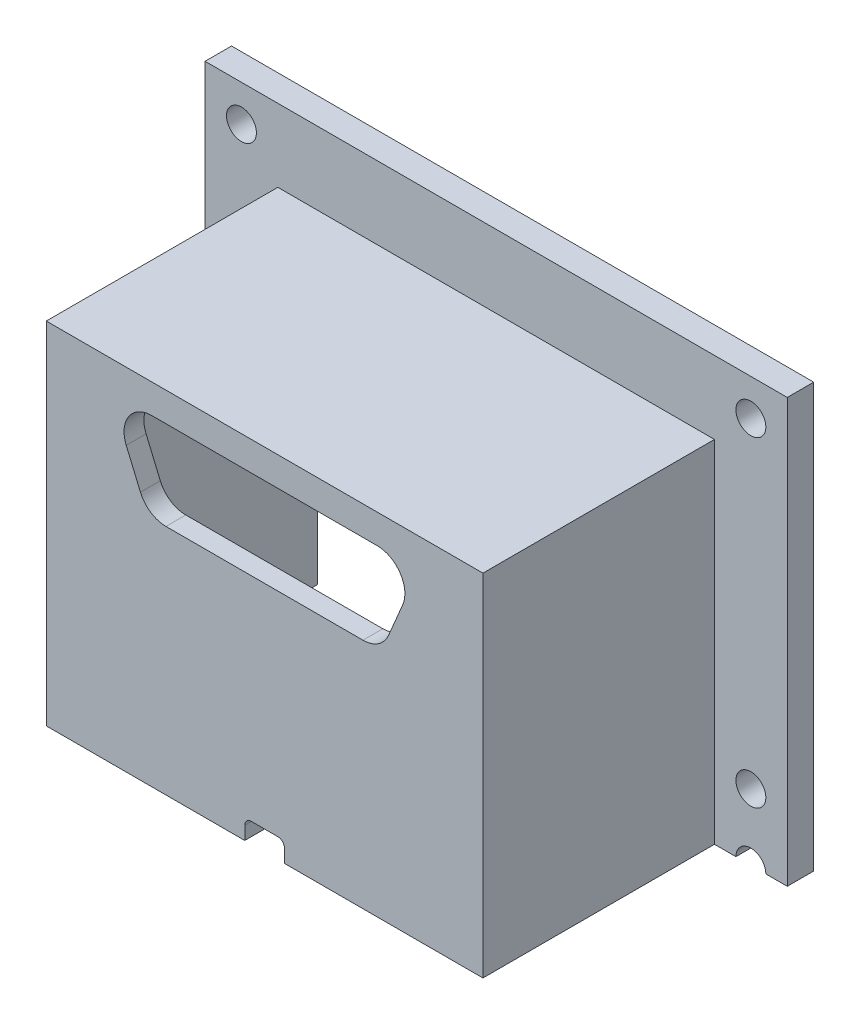
from build123d import *

# Parameters (mm, degrees)
SKETCH1_W                   = 33
SKETCH1_H                   = 53
SKETCH1_W_2                 = 31
SKETCH1_H_2                 = 51
WALL_HEIGHT_DEPTH           = 18
ROOF_START                  = 18
SKETCH1_3_W                 = 33
SKETCH1_3_H                 = 53
SKETCH1_3_W_2               = 3
SKETCH1_3_H_2               = 3
ROOF_DEPTH                  = 1.5
SKETCH1_5_W                 = 44
SKETCH1_5_H                 = 64
SKETCH1_5_R                 = 1.1303
SKETCH1_5_W_2               = 33
SKETCH1_5_H_2               = 53
SCREW_LIP_DEPTH             = 2
MICRO_D_START               = 18
MICRO_D_FEMALE_CUTOUT_DEPTH = 1.5
FILLET1_R                   = 0.5
SKETCH4_W                   = 44
SKETCH4_H                   = 32
CUT_EXTRUDE3_DEPTH          = 19.5


# Read off the part's stored shape, not the designer's step: Micro-D Female Cutout
with BuildPart() as part:
    # Sketch1 → Wall_Height (new body)
    with BuildSketch(Plane.XY):
        with Locations((16.5, -26.5)):
            Rectangle(SKETCH1_W, SKETCH1_H)
        with Locations((16.5, -26.5)):
            Rectangle(SKETCH1_W_2, SKETCH1_H_2, mode=Mode.SUBTRACT)
    extrude(amount=WALL_HEIGHT_DEPTH)

    # Sketch1<3> → Roof (add)
    with BuildSketch(Plane.XY.offset(ROOF_START)):
        with Locations((16.5, -26.5)):
            Rectangle(SKETCH1_3_W, SKETCH1_3_H)
        with Locations((16.5, -26.5)):
            Rectangle(SKETCH1_3_W_2, SKETCH1_3_H_2, mode=Mode.SUBTRACT)
    extrude(amount=ROOF_DEPTH)

    # Sketch1<5> → Screw_Lip (add)
    with BuildSketch(Plane.XY):
        with Locations((16.5, -26.5)):
            Rectangle(SKETCH1_5_W, SKETCH1_5_H)
        with Locations((35.75, -31.5)):
            Circle(SKETCH1_5_R, mode=Mode.SUBTRACT)
        with Locations((35.75, -21.5)):
            Circle(SKETCH1_5_R, mode=Mode.SUBTRACT)
        with Locations((-2.75, -31.5)):
            Circle(SKETCH1_5_R, mode=Mode.SUBTRACT)
        with Locations((-2.75, -21.5)):
            Circle(SKETCH1_5_R, mode=Mode.SUBTRACT)
        with Locations((35.75, -55.75)):
            Circle(SKETCH1_5_R, mode=Mode.SUBTRACT)
        with Locations((35.75, -26.5)):
            Circle(SKETCH1_5_R, mode=Mode.SUBTRACT)
        with Locations((-2.75, -26.5)):
            Circle(SKETCH1_5_R, mode=Mode.SUBTRACT)
        with Locations((-2.75, -55.75)):
            Circle(SKETCH1_5_R, mode=Mode.SUBTRACT)
        with Locations((-2.75, 2.75)):
            Circle(SKETCH1_5_R, mode=Mode.SUBTRACT)
        with Locations((35.75, 2.75)):
            Circle(SKETCH1_5_R, mode=Mode.SUBTRACT)
        with Locations((16.5, -26.5)):
            Rectangle(SKETCH1_5_W_2, SKETCH1_5_H_2, mode=Mode.SUBTRACT)
    extrude(amount=SCREW_LIP_DEPTH)

    # Micro-D Female Cutout outline → Micro-D Female Cutout (cut)
    with BuildSketch(Plane.XY.offset(MICRO_D_START)):
        with BuildLine():
            Line((9.045291306, -8.922906796), (23.934708694, -8.922906796))
            ThreePointArc((23.934708694, -8.922906796), (25.091998708, -8.574294286), (25.86418098, -7.644463442))
            Line((25.86418098, -7.644463442), (26.936222286, -5.112028361))
            ThreePointArc((26.936222286, -5.112028361), (26.753373348, -3.137945843), (25.00675, -2.2))
            Line((25.00675, -2.2), (7.97325, -2.2))
            ThreePointArc((7.97325, -2.2), (6.226626652, -3.137945843), (6.043777714, -5.112028361))
            Line((6.043777714, -5.112028361), (7.11581902, -7.644463442))
            ThreePointArc((7.11581902, -7.644463442), (7.888001292, -8.574294286), (9.045291306, -8.922906796))
        make_face()
    micro_d_female_cutout = extrude(amount=MICRO_D_FEMALE_CUTOUT_DEPTH, mode=Mode.SUBTRACT)

    # Micro-D Cutout Mirror: Micro-D Female Cutout across plane
    add(micro_d_female_cutout.mirror(Plane.ZX.offset(-26.5)), mode=Mode.SUBTRACT)

    # Fillet1
    fillet1_edges = [part.edges().sort_by_distance(p)[0] for p in [
        (1, -1, 9),
        (1, -52, 9),
        (32, -52, 9),
        (32, -1, 9),
        (15, -28, 18.75),
        (18, -28, 18.75),
        (18, -25, 18.75),
        (15, -25, 18.75),
    ]]
    fillet(fillet1_edges, radius=FILLET1_R)

    # Sketch4 → Cut-Extrude3 (cut)
    with BuildSketch(Plane.XY):
        with Locations((16.5, -42.5)):
            Rectangle(SKETCH4_W, SKETCH4_H)
    extrude(amount=CUT_EXTRUDE3_DEPTH, mode=Mode.SUBTRACT)


solid = part.part
